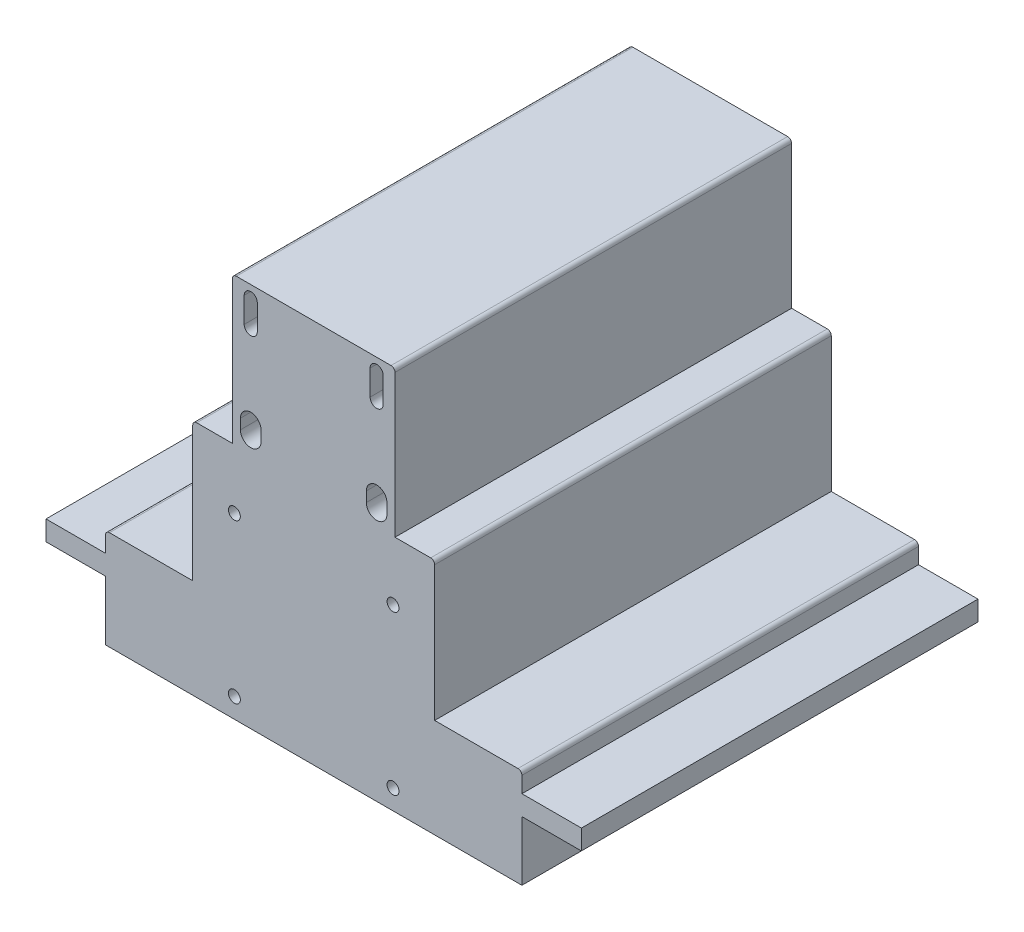
from build123d import *

# Parameters (mm, degrees)
SKETCH1_R           = 0.15
BOSS_EXTRUDE1_DEPTH = 10
FILLET2_R           = 0.1


with BuildPart() as part:
    # Sketch1 → Boss-Extrude1 (new body)
    with BuildSketch(Plane.XY):
        Polygon((0, 0), (10.5, 0), (10.5, 1.5), (12, 1.5), (12, 2), (10.5, 2), (10.5, 2.5), (8.3, 2.5), (8.3, 6), (7.3, 6), (7.3, 9.7), (3.2, 9.7), (3.2, 6), (2.2, 6), (2.2, 2.5), (0, 2.5), (0, 2), (-1.5, 2), (-1.5, 1.5), (0, 1.5), align=None)
        with Locations((3.25, 0.5)):
            Circle(SKETCH1_R, mode=Mode.SUBTRACT)
        with Locations((7.25, 0.5)):
            Circle(SKETCH1_R, mode=Mode.SUBTRACT)
        with Locations((7.25, 4.5)):
            Circle(SKETCH1_R, mode=Mode.SUBTRACT)
        with Locations((3.25, 4.5)):
            Circle(SKETCH1_R, mode=Mode.SUBTRACT)
        with BuildLine():
            Line((3.8275, 9.382), (3.8275, 8.747))
            ThreePointArc((3.8275, 8.747), (3.6625, 8.582), (3.4975, 8.747))
            Line((3.4975, 8.747), (3.4975, 9.382))
            ThreePointArc((3.4975, 9.382), (3.6625, 9.547), (3.8275, 9.382))
        make_face(mode=Mode.SUBTRACT)
        with BuildLine():
            Line((6.6725, 9.382), (6.6725, 8.747))
            ThreePointArc((6.6725, 8.747), (6.8375, 8.582), (7.0025, 8.747))
            Line((7.0025, 8.747), (7.0025, 9.382))
            ThreePointArc((7.0025, 9.382), (6.8375, 9.547), (6.6725, 9.382))
        make_face(mode=Mode.SUBTRACT)
        with BuildLine():
            Line((3.4025, 6.3975), (3.4025, 6.6515))
            ThreePointArc((3.4025, 6.6515), (3.6625, 6.9115), (3.9225, 6.6515))
            Line((3.9225, 6.6515), (3.9225, 6.3975))
            ThreePointArc((3.9225, 6.3975), (3.6625, 6.1375), (3.4025, 6.3975))
        make_face(mode=Mode.SUBTRACT)
        with BuildLine():
            Line((7.0975, 6.3975), (7.0975, 6.6515))
            ThreePointArc((7.0975, 6.6515), (6.8375, 6.9115), (6.5775, 6.6515))
            Line((6.5775, 6.6515), (6.5775, 6.3975))
            ThreePointArc((6.5775, 6.3975), (6.8375, 6.1375), (7.0975, 6.3975))
        make_face(mode=Mode.SUBTRACT)
    extrude(amount=BOSS_EXTRUDE1_DEPTH)

    # Fillet2
    fillet2_edges = [part.edges().sort_by_distance(p)[0] for p in [
        (0, 2.5, 5),
        (2.2, 6, 5),
        (10.5, 2.5, 5),
        (8.3, 6, 5),
        (7.3, 9.7, 5),
        (3.2, 9.7, 5),
    ]]
    fillet(fillet2_edges, radius=FILLET2_R)


solid = part.part
